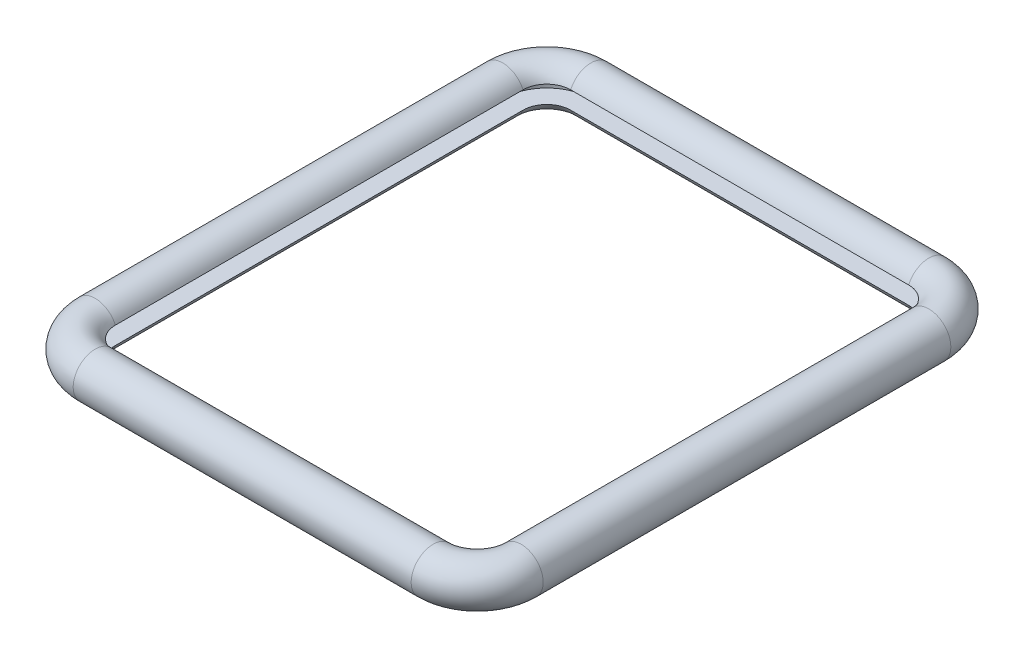
from build123d import *

# Parameters (mm, degrees)
BOSS_EXTRUDE1_DEPTH = 2
SWEEP2_PROFILE_R    = 5
INTERSECT1_START    = -2
INTERSECT1_DEPTH    = 4


# Read off the part's stored shape, not the designer's step: Intersect1
with BuildPart() as part:
    # Sketch1 → Boss-Extrude1 (new, symmetric)
    with BuildSketch(Plane(origin=(0, 0, 0), x_dir=(1, 0, 0), z_dir=(0, 1, 0))):
        with BuildLine():
            Line((-52.048116563, 47.218434745), (24.754223647, 47.218434745))
            ThreePointArc((24.754223647, 47.218434745), (31.825291459, 44.289502557), (34.754223647, 37.218434745))
            Line((34.754223647, 37.218434745), (34.754223647, -55.414363356))
            ThreePointArc((34.754223647, -55.414363356), (31.825291459, -62.485431168), (24.754223647, -65.414363356))
            Line((24.754223647, -65.414363356), (-52.048116563, -65.414363356))
            ThreePointArc((-52.048116563, -65.414363356), (-59.119184375, -62.485431168), (-62.048116563, -55.414363356))
            Line((-62.048116563, -55.414363356), (-62.048116563, 37.218434745))
            ThreePointArc((-62.048116563, 37.218434745), (-59.119184375, 44.289502557), (-52.048116563, 47.218434745))
        make_face()
    extrude(amount=BOSS_EXTRUDE1_DEPTH, both=True)


with BuildPart() as body_2:
    # Sweep2: sweep along a path in Sketch1<3>
    with BuildLine(Plane(origin=(0, 0, 0), x_dir=(1, 0, 0), z_dir=(0, 1, 0))) as sweep2_path:
        Line((-52.048116563, 47.218434745), (24.754223647, 47.218434745))
        ThreePointArc((24.754223647, 47.218434745), (31.825291459, 44.289502557), (34.754223647, 37.218434745))
        Line((34.754223647, 37.218434745), (34.754223647, -55.414363356))
        ThreePointArc((34.754223647, -55.414363356), (31.825291459, -62.485431168), (24.754223647, -65.414363356))
        Line((24.754223647, -65.414363356), (-52.048116563, -65.414363356))
        ThreePointArc((-52.048116563, -65.414363356), (-59.119184375, -62.485431168), (-62.048116563, -55.414363356))
        Line((-62.048116563, -55.414363356), (-62.048116563, 37.218434745))
        ThreePointArc((-62.048116563, 37.218434745), (-59.119184375, 44.289502557), (-52.048116563, 47.218434745))
    # Sweep2 profile (on start of the path) → Sweep2 (sweep)
    with BuildSketch(Plane(origin=(-52.048116563, 0, -47.218434745), x_dir=(0, 0, 1), z_dir=(1, 0, 0))):
        Circle(SWEEP2_PROFILE_R)
    sweep(path=sweep2_path.line)


with BuildPart() as intersect1_tool:
    # Intersect1 outline → Intersect1 (new body)
    with BuildSketch(Plane(origin=(0, 0, 0), x_dir=(1, 0, 0), z_dir=(0, 1, 0)).offset(INTERSECT1_START)):
        with BuildLine():
            ThreePointArc((-52.048116563, 47.218434745), (-59.119184375, 44.289502557), (-62.048116563, 37.218434745))
            Line((-62.048116563, 37.218434745), (-62.048116563, -55.414363356))
            ThreePointArc((-62.048116563, -55.414363356), (-59.119184375, -62.485431168), (-52.048116563, -65.414363356))
            Line((-52.048116563, -65.414363356), (24.754223647, -65.414363356))
            ThreePointArc((24.754223647, -65.414363356), (31.825291459, -62.485431168), (34.754223647, -55.414363356))
            Line((34.754223647, -55.414363356), (34.754223647, 37.218434745))
            ThreePointArc((34.754223647, 37.218434745), (31.825291459, 44.289502557), (24.754223647, 47.218434745))
            Line((24.754223647, 47.218434745), (-52.048116563, 47.218434745))
        make_face()
    extrude(amount=INTERSECT1_DEPTH)


with BuildPart() as part_1:
    add(part.part)

    # Intersect1: cut by intersect1_tool
    add(intersect1_tool.part, mode=Mode.SUBTRACT)


with BuildPart() as body_2_1:
    add(body_2.part)

    # Intersect1: cut by intersect1_tool
    add(intersect1_tool.part, mode=Mode.SUBTRACT)


solid = body_2_1.part
